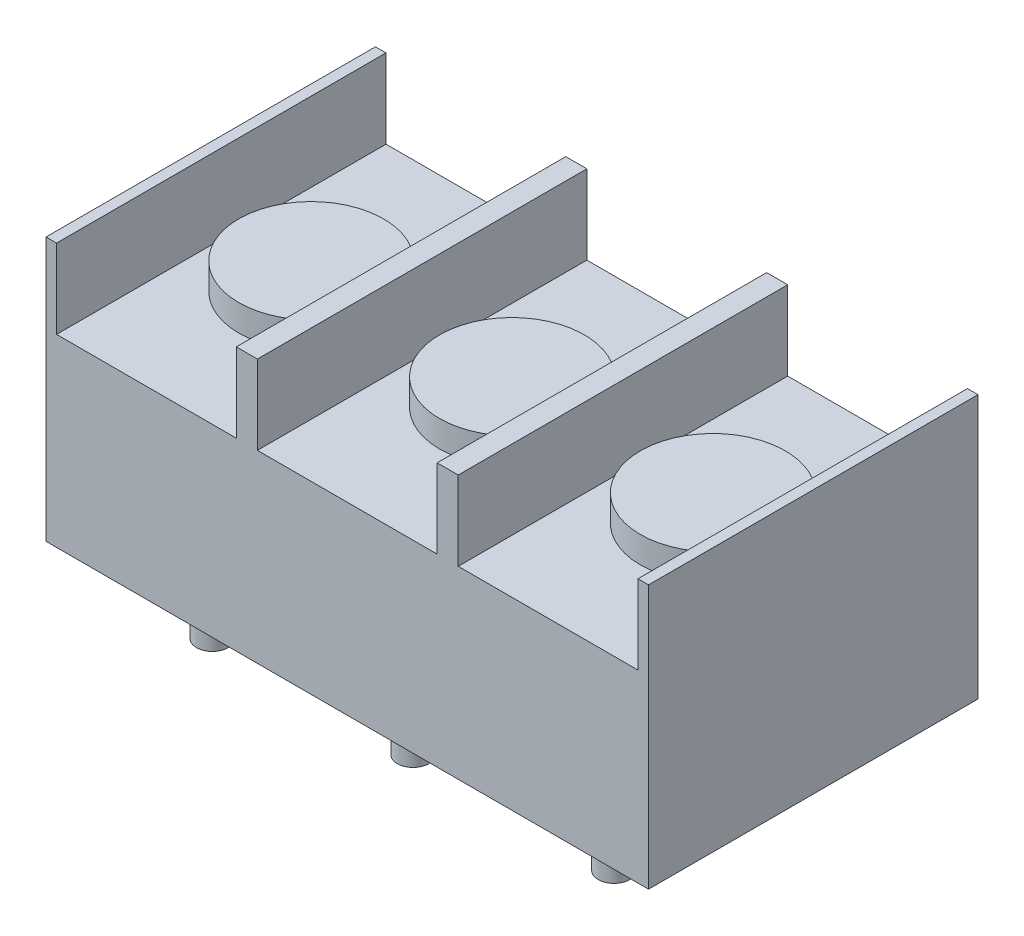
from build123d import *

# Parameters (mm, degrees)
SKETCH_1_W          = 22.86
SKETCH_1_H          = 12.5
EXTRUDE_1_DEPTH     = 10
SKETCH_2_W          = 6.82
SKETCH_2_H          = 12.5
CUT_EXTRUDE_1_DEPTH = 3
SKETCH_3_R          = 0.6
EXTRUDE_2_DEPTH     = 2.54
SKETCH_4_R          = 2.75
EXTRUDE_3_DEPTH     = 1


with BuildPart() as part:
    # 草图1 → 拉伸1 (new body)
    with BuildSketch(Plane(origin=(0, 0, 0), x_dir=(1, 0, 0), z_dir=(0, 1, 0))):
        Rectangle(SKETCH_1_W, SKETCH_1_H)
    extrude(amount=EXTRUDE_1_DEPTH)

    # 草图2 → 切除-拉伸1 (cut)
    with BuildSketch(Plane(origin=(0, 10, 0), x_dir=(-1, 0, 0), z_dir=(0, 1, 0))):
        with Locations((-7.62, 0)):
            Rectangle(SKETCH_2_W, SKETCH_2_H)
        Rectangle(SKETCH_2_W, SKETCH_2_H)
        with Locations((7.62, 0)):
            Rectangle(SKETCH_2_W, SKETCH_2_H)
    extrude(amount=-CUT_EXTRUDE_1_DEPTH, mode=Mode.SUBTRACT)

    # 草图3 → 拉伸2 (add)
    with BuildSketch(Plane.XZ):
        with Locations((0, 3.75)):
            Circle(SKETCH_3_R)
        with Locations((7.62, 3.75)):
            Circle(SKETCH_3_R)
        with Locations((-7.62, 3.75)):
            Circle(SKETCH_3_R)
    extrude(amount=EXTRUDE_2_DEPTH)

    # 草图4 → 拉伸3 (add)
    with BuildSketch(Plane(origin=(0, 7, 0), x_dir=(-1, 0, 0), z_dir=(0, 1, 0))):
        Circle(SKETCH_4_R)
        with Locations((7.62, 0)):
            Circle(SKETCH_4_R)
        with Locations((-7.62, 0)):
            Circle(SKETCH_4_R)
    extrude(amount=EXTRUDE_3_DEPTH)


solid = part.part
